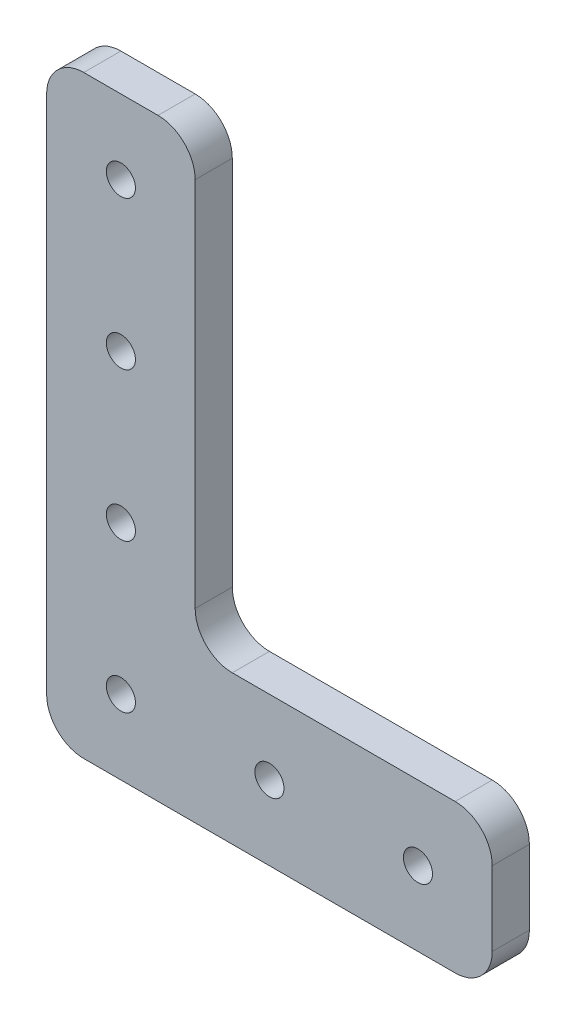
from build123d import *

# Parameters (mm, degrees)
SKETCH1_R           = 2.4892
BOSS_EXTRUDE1_DEPTH = 6.35
FILLET1_R           = 6.35


with BuildPart() as part:
    # Sketch1 → Boss-Extrude1 (new body)
    with BuildSketch(Plane.XY):
        Polygon((0, 0), (0, 101.6), (25.4, 101.6), (25.4, 25.4), (76.2, 25.4), (76.2, 0), align=None)
        with Locations((12.7, 12.7)):
            Circle(SKETCH1_R, mode=Mode.SUBTRACT)
        with Locations((38.1, 12.7)):
            Circle(SKETCH1_R, mode=Mode.SUBTRACT)
        with Locations((63.5, 12.7)):
            Circle(SKETCH1_R, mode=Mode.SUBTRACT)
        with Locations((12.7, 38.1)):
            Circle(SKETCH1_R, mode=Mode.SUBTRACT)
        with Locations((12.7, 63.5)):
            Circle(SKETCH1_R, mode=Mode.SUBTRACT)
        with Locations((12.7, 88.9)):
            Circle(SKETCH1_R, mode=Mode.SUBTRACT)
    extrude(amount=BOSS_EXTRUDE1_DEPTH)

    # Fillet1
    fillet1_edges = [part.edges().sort_by_distance(p)[0] for p in [
        (0, 0, 3.175),
        (0, 101.6, 3.175),
        (25.4, 25.4, 3.175),
        (76.2, 25.4, 3.175),
        (76.2, 0, 3.175),
        (25.4, 101.6, 3.175),
    ]]
    fillet(fillet1_edges, radius=FILLET1_R)


solid = part.part
